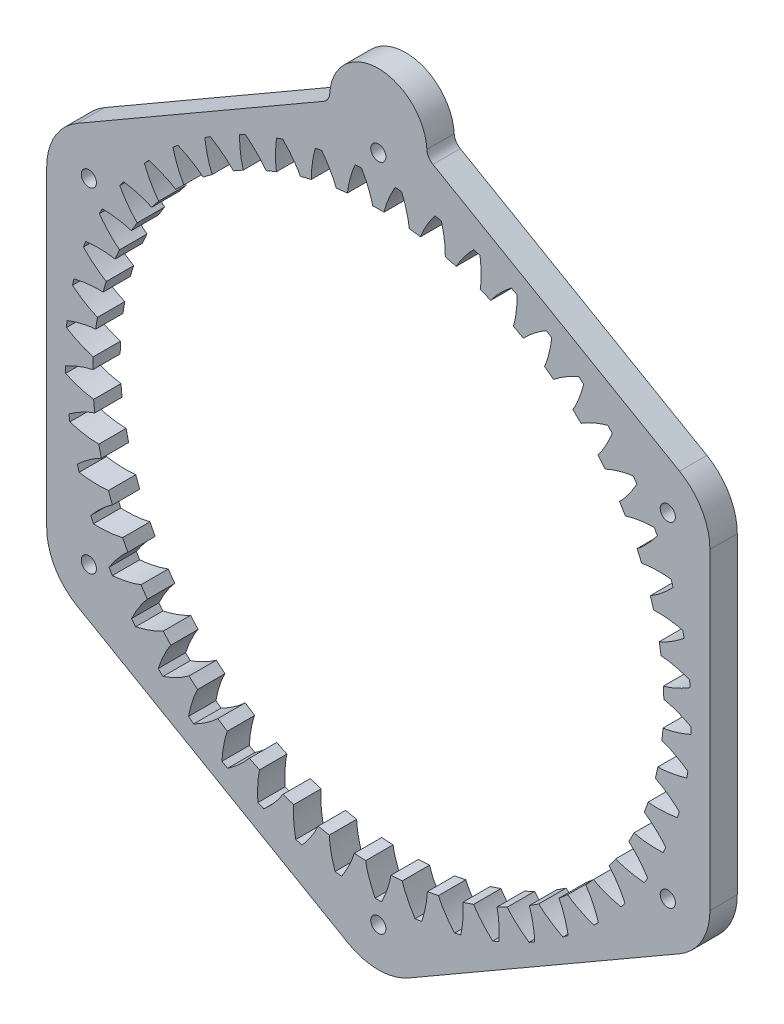
from build123d import *

# Parameters (mm, degrees)
SKETCH_1_R               = 56.000000007
SKETCH_1_R_2             = 51.5
EXTRUDE_1_DEPTH          = 4.5
EXTRUDE_2_DEPTH          = 5
PATTERN_CIRCULAR_1_COUNT = 49
EXTRUDE_START            = -4.5
SKETCH_4_R               = 63
SKETCH_4_R_2             = 56.000000007
EXTRUDE_3_DEPTH          = 4.5
CUT_EXTRUDE_1_REACH      = 91.209
SKETCH_5_R               = 1.25
SKETCH_8_R               = 3
CUT_EXTRUDE_4_DEPTH      = 2.5
CUT_EXTRUDE_5_DEPTH      = 10
FILLET_1_R               = 10
EXTRUDE_START_2          = -5
EXTRUDE_4_DEPTH          = 5
SKETCH_11_R              = 3.05
CUT_EXTRUDE_6_DEPTH      = 3.5
FILLET_2_R               = 2
FILLET_3_R               = 0.5
CUT_EXTRUDE_START        = -0.5
SKETCH_12_R              = 52.371897219
CUT_EXTRUDE_7_DEPTH      = 0.5
SKETCH_13_R              = 12.5
CUT_EXTRUDE_8_DEPTH      = 0.5


with BuildPart() as part:
    # 草图1 → 凸台-拉伸1 (new body)
    with BuildSketch(Plane.XY):
        Circle(SKETCH_1_R)
        Circle(SKETCH_1_R_2, mode=Mode.SUBTRACT)
    extrude(amount=EXTRUDE_1_DEPTH)

    # 草图2 → 凸台-拉伸2 (add)
    with BuildSketch(Plane.XY):
        with BuildLine():
            ThreePointArc((0.931553663, 46.96516004), (0, 46.974397813), (-0.931553663, 46.96516004))
            add(Edge.make_bspline(
                [(-0.931553663, 46.96516004), (-0.961179394, 47.098158185), (-1.012126824, 47.305625137), (-1.091220113, 47.591985766), (-1.162704579, 47.832007732), (-1.244577368, 48.088098142), (-1.337508077, 48.359930452), (-1.44215654, 48.647157844), (-1.559173216, 48.949413445), (-1.689198378, 49.266310575), (-1.83286166, 49.597443012), (-1.990781514, 49.942385264), (-2.163564685, 50.300692854), (-2.351805755, 50.671902625), (-2.556086402, 51.055533053), (-2.856592591, 51.593655943), (-3.098978337, 51.998132769), (-3.268937014, 52.269777779)],
                knots=[0, 0, 0, 0, 0.070200933, 0.110046012, 0.153054166, 0.199225395, 0.2485597, 0.301057079, 0.356717533, 0.415541063, 0.477527667, 0.542677347, 0.610990101, 0.682465931, 0.757104836, 0.834906815, 1, 1, 1, 1], degree=3))
            ThreePointArc((-3.268937014, 52.269777779), (0, 52.371897219), (3.268937014, 52.269777779))
            add(Edge.make_bspline(
                [(0.931553663, 46.96516004), (0.961179394, 47.098158185), (1.012126824, 47.305625137), (1.091220113, 47.591985766), (1.162704579, 47.832007732), (1.244577368, 48.088098142), (1.337508077, 48.359930452), (1.44215654, 48.647157844), (1.559173216, 48.949413445), (1.689198378, 49.266310575), (1.83286166, 49.597443012), (1.990781514, 49.942385264), (2.163564685, 50.300692854), (2.351805755, 50.671902625), (2.556086402, 51.055533053), (2.856592591, 51.593655943), (3.098978337, 51.998132769), (3.268937014, 52.269777779)],
                knots=[0, 0, 0, 0, 0.070200933, 0.110046012, 0.153054166, 0.199225395, 0.2485597, 0.301057079, 0.356717533, 0.415541063, 0.477527667, 0.542677347, 0.610990101, 0.682465931, 0.757104836, 0.834906815, 1, 1, 1, 1], degree=3))
        make_face()
    extrude_2 = extrude(amount=EXTRUDE_2_DEPTH)

    # 阵列(圆周)1: 凸台-拉伸2 ×49 about axis
    pattern_circular_1_axis = Axis((0, 0, -0.25), (0, 0, 1))
    for i in range(1, PATTERN_CIRCULAR_1_COUNT):
        add(extrude_2.rotate(pattern_circular_1_axis, i * 360 / PATTERN_CIRCULAR_1_COUNT))

    # 草图4 → 凸台-拉伸3 (add)
    with BuildSketch(Plane.XY.offset(4.5).offset(EXTRUDE_START)):
        Circle(SKETCH_4_R)
        Circle(SKETCH_4_R_2, mode=Mode.SUBTRACT)
    extrude(amount=EXTRUDE_3_DEPTH)

    # 草图5 → 切除-拉伸1 (cut, up to next)
    with BuildSketch(Plane.XY.offset(4.5), mode=Mode.PRIVATE) as cut_extrude_1_sk1:
        with Locations((0, 55)):
            Circle(SKETCH_5_R)
    cut_extrude_1_tool1 = extrude(cut_extrude_1_sk1.sketch, amount=-CUT_EXTRUDE_1_REACH, mode=Mode.PRIVATE) & part.part
    # 草图5 → 切除-拉伸1 (cut, up to next)
    with BuildSketch(Plane.XY.offset(4.5), mode=Mode.PRIVATE) as cut_extrude_1_sk2:
        with Locations((47.631397208, 27.5)):
            Circle(SKETCH_5_R)
    cut_extrude_1_tool2 = extrude(cut_extrude_1_sk2.sketch, amount=-CUT_EXTRUDE_1_REACH, mode=Mode.PRIVATE) & part.part
    # 草图5 → 切除-拉伸1 (cut, up to next)
    with BuildSketch(Plane.XY.offset(4.5), mode=Mode.PRIVATE) as cut_extrude_1_sk3:
        with Locations((47.631397208, -27.5)):
            Circle(SKETCH_5_R)
    cut_extrude_1_tool3 = extrude(cut_extrude_1_sk3.sketch, amount=-CUT_EXTRUDE_1_REACH, mode=Mode.PRIVATE) & part.part
    # 草图5 → 切除-拉伸1 (cut, up to next)
    with BuildSketch(Plane.XY.offset(4.5), mode=Mode.PRIVATE) as cut_extrude_1_sk4:
        with Locations((0, -55)):
            Circle(SKETCH_5_R)
    cut_extrude_1_tool4 = extrude(cut_extrude_1_sk4.sketch, amount=-CUT_EXTRUDE_1_REACH, mode=Mode.PRIVATE) & part.part
    # 草图5 → 切除-拉伸1 (cut, up to next)
    with BuildSketch(Plane.XY.offset(4.5), mode=Mode.PRIVATE) as cut_extrude_1_sk5:
        with Locations((-47.631397208, -27.5)):
            Circle(SKETCH_5_R)
    cut_extrude_1_tool5 = extrude(cut_extrude_1_sk5.sketch, amount=-CUT_EXTRUDE_1_REACH, mode=Mode.PRIVATE) & part.part
    # 草图5 → 切除-拉伸1 (cut, up to next)
    with BuildSketch(Plane.XY.offset(4.5), mode=Mode.PRIVATE) as cut_extrude_1_sk6:
        with Locations((-47.631397208, 27.5)):
            Circle(SKETCH_5_R)
    cut_extrude_1_tool6 = extrude(cut_extrude_1_sk6.sketch, amount=-CUT_EXTRUDE_1_REACH, mode=Mode.PRIVATE) & part.part
    add(cut_extrude_1_tool1.solids().sort_by_distance((0, 55, 4.5))[0], mode=Mode.SUBTRACT)
    add(cut_extrude_1_tool2.solids().sort_by_distance((47.631397, 27.5, 4.5))[0], mode=Mode.SUBTRACT)
    add(cut_extrude_1_tool3.solids().sort_by_distance((47.631397, -27.5, 4.5))[0], mode=Mode.SUBTRACT)
    add(cut_extrude_1_tool4.solids().sort_by_distance((0, -55, 4.5))[0], mode=Mode.SUBTRACT)
    add(cut_extrude_1_tool5.solids().sort_by_distance((-47.631397, -27.5, 4.5))[0], mode=Mode.SUBTRACT)
    add(cut_extrude_1_tool6.solids().sort_by_distance((-47.631397, 27.5, 4.5))[0], mode=Mode.SUBTRACT)

    # 草图8 → 切除-拉伸4 (cut)
    with BuildSketch(Plane(origin=(0, 0, 0), x_dir=(-1, 0, 0), z_dir=(0, 0, -1))):
        with Locations((0, 55)):
            Circle(SKETCH_8_R)
        with Locations((47.631397208, 27.5)):
            Circle(SKETCH_8_R)
        with Locations((47.631397208, -27.5)):
            Circle(SKETCH_8_R)
        with Locations((0, -55)):
            Circle(SKETCH_8_R)
        with Locations((-47.631397208, -27.5)):
            Circle(SKETCH_8_R)
        with Locations((-47.631397208, 27.5)):
            Circle(SKETCH_8_R)
    extrude(amount=-CUT_EXTRUDE_4_DEPTH, mode=Mode.SUBTRACT)

    # 草图9 → 切除-拉伸5 (cut)
    with BuildSketch(Plane(origin=(0, 0, 0), x_dir=(-1, 0, 0), z_dir=(0, 0, -1))):
        with BuildLine():
            Line((-54.559600438, -31.5), (-54.559600438, 31.5))
            ThreePointArc((-54.559600438, 31.5), (-63, 0), (-54.559600438, -31.5))
        make_face()
        with BuildLine():
            Line((0, -63), (-54.559600438, -31.5))
            ThreePointArc((-54.559600438, -31.5), (-31.5, -54.559600438), (0, -63))
        make_face()
        with BuildLine():
            ThreePointArc((0, -63), (31.5, -54.559600438), (54.559600438, -31.5))
            Line((54.559600438, -31.5), (0, -63))
        make_face()
        with BuildLine():
            ThreePointArc((63, 0), (60.853327056, 16.305599841), (54.559600438, 31.5))
            Line((54.559600438, 31.5), (54.559600438, -31.5))
            ThreePointArc((54.559600438, -31.5), (60.853327056, -16.305599841), (63, 0))
        make_face()
        with BuildLine():
            ThreePointArc((54.559600438, 31.5), (31.5, 54.559600438), (0, 63))
            Line((0, 63), (54.559600438, 31.5))
        make_face()
        with BuildLine():
            Line((-54.559600438, 31.5), (0, 63))
            ThreePointArc((0, 63), (-31.5, 54.559600438), (-54.559600438, 31.5))
        make_face()
    extrude(amount=-CUT_EXTRUDE_5_DEPTH, mode=Mode.SUBTRACT)

    # 圆角1
    fillet_1_edges = [part.edges().sort_by_distance(p)[0] for p in [
        (54.559600438, -31.5, 2.25),
        (54.559600438, 31.5, 2.25),
        (-54.559600438, -31.5, 2.25),
        (0, -63, 2.25),
        (0, 63, 2.25),
        (-54.559600438, 31.5, 2.25),
    ]]
    fillet(fillet_1_edges, radius=FILLET_1_R)

    # 草图10 → 凸台-拉伸4 (add)
    with BuildSketch(Plane(origin=(0, 0, 0), x_dir=(-1, 0, 0), z_dir=(0, 0, -1)).offset(EXTRUDE_START_2)):
        with BuildLine():
            Line((-8, 57.452994616), (-8, 59))
            ThreePointArc((-8, 59), (0, 67), (8, 59))
            Line((8, 59), (8, 57.452994616))
            ThreePointArc((8, 57.452994616), (0, 61.452994616), (-8, 57.452994616))
        make_face()
    extrude(amount=EXTRUDE_4_DEPTH)

    # 草图11 → 切除-拉伸6 (cut)
    with BuildSketch(Plane(origin=(0, 0, 0), x_dir=(-1, 0, 0), z_dir=(0, 0, -1))):
        with Locations((0, 63)):
            Circle(SKETCH_11_R)
    extrude(amount=-CUT_EXTRUDE_6_DEPTH, mode=Mode.SUBTRACT)

    # 圆角2
    # the kernel refuses this fillet: 2 mm, written as the material it adds along each edge
    with BuildSketch(Plane(origin=(8, 58.381197846, 0), x_dir=(0.8660254037844389, -0.4999999999999995, 0), z_dir=(0, 0, 1))) as fillet_2_piece_1:
        with BuildLine():
            CenterArc((1.137572917, 2), FILLET_2_R, 213.121081905, 56.878918095)
            Line((-0.537462528, 0.907179677), (-0.704966072, 0.797897645))
            ThreePointArc((-0.704966072, 0.797897645), (-0.482606158, 0.435898385), (-0.173205081, -0.1))
            Line((-0.173205081, -0.1), (0, -0.2))
            Line((0, -0.2), (1.137572917, -0.2))
            Line((1.137572917, -0.2), (1.137572917, 0))
        make_face()
    extrude(amount=4.5)
    with BuildSketch(Plane(origin=(-8, 58.381197846, 4.5), x_dir=(0.011253725938793783, 0.9999366748212081, 0), z_dir=(0, 0, -1))) as fillet_2_piece_2:
        with BuildLine():
            CenterArc((1.140850159, -1.998132392), FILLET_2_R, 92.476277294, 56.878918095)
            Line((-0.57983724, -0.978703692), (-0.75190598, -0.876760822))
            Line((-0.75190598, -0.876760822), (-0.17206874, 0.10194287))
            Line((-0.17206874, 0.10194287), (0.002250745, 0.199987335))
            ThreePointArc((0.002250745, 0.199987335), (0.621013713, 0.193023505), (1.045797535, 0.199813239))
            Line((1.045797535, 0.199813239), (1.054438682, 0))
        make_face()
    extrude(amount=4.5)

    # 圆角3
    fillet_3_edges = [part.edges().sort_by_distance(p)[0] for p in [
        (3.05, 63, 0),
    ]]
    fillet(fillet_3_edges, radius=FILLET_3_R)

    # 草图12 → 切除-拉伸7 (cut)
    with BuildSketch(Plane.XY.offset(5).offset(CUT_EXTRUDE_START)):
        Circle(SKETCH_12_R)
    extrude(amount=CUT_EXTRUDE_7_DEPTH, mode=Mode.SUBTRACT)

    # 草图13 → 切除-拉伸8 (cut)
    with BuildSketch(Plane.XY.offset(5)):
        with Locations((0, 55)):
            Circle(SKETCH_13_R)
    extrude(amount=-CUT_EXTRUDE_8_DEPTH, mode=Mode.SUBTRACT)


solid = part.part
